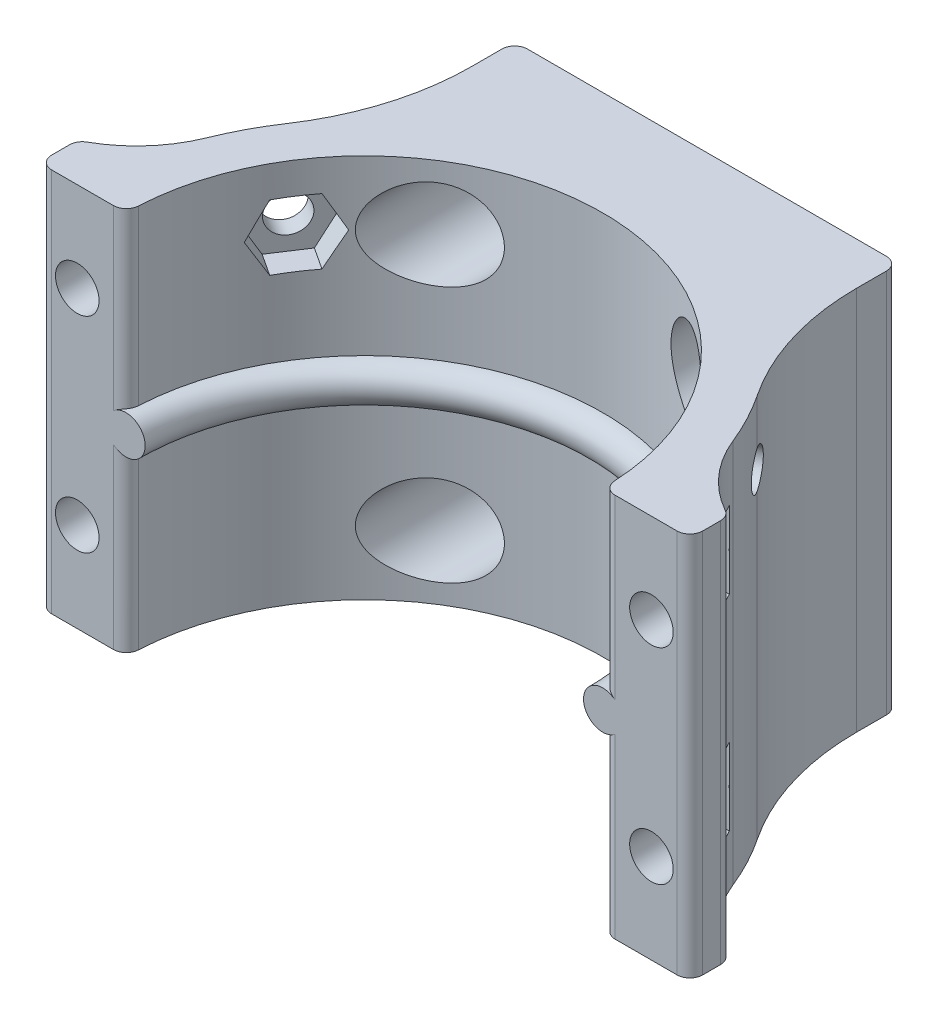
from build123d import *

# Parameters (mm, degrees)
ESQUISSE1_W                  = 30
ESQUISSE1_H                  = 30
BOSS_EXTRU_1_DEPTH           = 10.5
BOSS_EXTRU_2_DEPTH           = 15
ENL_V_MAT_EXTRU_1_DEPTH      = 48.535756267
R_VOLUTION1_ANGLE            = 180
CONG_1_R                     = 20
CONG_3_R                     = 10
CONG_4_R                     = 1
PER_AGEAVANC_1_START         = 4
PER_AGEAVANC_1_OUTLINE_R     = 3.5
PER_AGEAVANC_1_DEPTH         = 9.934989892
PER_AGEAVANC_1_2_OUTLINE_R   = 1.7
PER_AGEAVANC_1_2_DEPTH       = 4
PER_AGEAVANC_2_START         = 18.936607193
PER_AGEAVANC_2_OUTLINE_R     = 1.7
PER_AGEAVANC_2_DEPTH         = 7.793303466
ESQUISSE14_W                 = 7
ESQUISSE14_H                 = 6
ENL_V_MAT_EXTRU_2_DEPTH      = 4.5
ESQUISSE17_R                 = 1.45
ENL_V_MAT_EXTRU_3_DEPTH      = 47.458215221
ENL_V_START                  = -2
ENL_V_MAT_EXTRU_4_DEPTH      = 46.221534381
R_P_TITION_CIRCULAIRE5_COUNT = 2
R_P_TITION_CIRCULAIRE5_ANGLE = 247


# Read off the part's stored shape, not the designer's step: PerçageAvancé1, PerçageAvancé2
with BuildPart() as part:
    # Esquisse1 → Boss.-Extru.1 (new body)
    with BuildSketch(Plane.XY):
        Rectangle(ESQUISSE1_W, ESQUISSE1_H)
    extrude(amount=BOSS_EXTRU_1_DEPTH)

    # Esquisse4 → Boss.-Extru.2 (add, symmetric)
    with BuildSketch(Plane(origin=(0, 0, 0), x_dir=(1, 0, 0), z_dir=(0, 1, 0))):
        with BuildLine():
            Line((18.6, -26.729910659), (25.4, -26.729910659))
            Line((25.4, -26.729910659), (25.4, -23.729910659))
            Line((25.4, -23.729910659), (21.895433314, -23.729910659))
            ThreePointArc((21.895433314, -23.729910659), (0, -4.629910659), (-21.895433314, -23.729910659))
            Line((-21.895433314, -23.729910659), (-25.4, -23.729910659))
            Line((-25.4, -23.729910659), (-25.4, -26.729910659))
            Line((-25.4, -26.729910659), (-18.6, -26.729910659))
            ThreePointArc((-18.6, -26.729910659), (0, -8.129910659), (18.6, -26.729910659))
        make_face()
    extrude(amount=BOSS_EXTRU_2_DEPTH, both=True)

    # Esquisse9 → Enlèv. mat.-Extru.1 (cut, through all)
    with BuildSketch(Plane(origin=(0, 15, 0), x_dir=(1, 0, 0), z_dir=(0, 1, 0))):
        with BuildLine():
            Line((-9.085703055, -10.5), (9.085703055, -10.5))
            ThreePointArc((9.085703055, -10.5), (0, -8.129910659), (-9.085703055, -10.5))
        make_face()
    extrude(amount=-ENL_V_MAT_EXTRU_1_DEPTH, mode=Mode.SUBTRACT)

    # Esquisse5 → Révolution1 (revolve)
    with BuildSketch(Plane.XY.offset(26.729910659)):
        with BuildLine():
            Line((-18.6, 1.5), (-18.6, -1.5))
            ThreePointArc((-18.6, -1.5), (-17.1, 0), (-18.6, 1.5))
        make_face()
    revolve(axis=Axis((0, 15, 26.729910659), (0, -1, 0)), revolution_arc=R_VOLUTION1_ANGLE)

    # Congé1
    cong_1_edges = [part.edges().sort_by_distance(p)[0] for p in [
        (-15, 0, 10.5),
        (15, 0, 10.5),
    ]]
    fillet(cong_1_edges, radius=CONG_1_R)

    # Congé3
    # the kernel refuses this fillet: 10 mm, written as the material it adds along each edge
    with BuildSketch(Plane(origin=(21.895433314, 15, 23.729910659), x_dir=(-0.25660960080470496, 0, -0.9665151384095596), z_dir=(0, -1, 0))) as cong_3_piece_1:
        with BuildLine():
            CenterArc((6.668397642, 9.924025594), CONG_3_R, 220.819703099, 42.113109107)
            Line((-0.899305458, 3.387216756), (-1.05065952, 3.256480579))
            ThreePointArc((-1.05065952, 3.256480579), (-0.642955757, 1.642286458), (-0.193303028, -0.05132192))
            Line((-0.193303028, -0.05132192), (0.024606633, -0.198480512))
            ThreePointArc((0.024606633, -0.198480512), (2.719032987, -0.032096562), (5.41345934, -0.198480512))
            Line((5.41345934, -0.198480512), (5.438065974, 0))
        make_face()
    extrude(amount=30)
    with BuildSketch(Plane(origin=(-21.895433314, 15, 23.729910659), x_dir=(0.2566096008047045, 0, -0.9665151384095596), z_dir=(0, -1, 0))) as cong_3_piece_2:
        with BuildLine():
            CenterArc((6.668397642, -9.924025594), CONG_3_R, 97.067187794, 42.113109107)
            Line((-0.899305458, -3.387216756), (-1.05065952, -3.256480579))
            ThreePointArc((-1.05065952, -3.256480579), (-0.642955757, -1.642286458), (-0.193303028, 0.05132192))
            Line((-0.193303028, 0.05132192), (0.024606633, 0.198480512))
            ThreePointArc((0.024606633, 0.198480512), (2.719032987, 0.032096562), (5.41345934, 0.198480512))
            Line((5.41345934, 0.198480512), (5.438065974, 0))
        make_face()
    extrude(amount=30)

    # Congé4
    cong_4_edges = [part.edges().sort_by_distance(p)[0] for p in [
        (-18.6, 8.25, 26.729910659),
        (25.4, 0, 23.729910659),
        (-25.4, 0, 23.729910659),
        (-25.4, 0, 26.729910659),
        (18.6, 8.25, 26.729910659),
        (25.4, 0, 26.729910659),
        (-15, 0, 0),
        (-18.6, -8.25, 26.729910659),
        (18.6, -8.25, 26.729910659),
        (15, 0, 0),
    ]]
    fillet(cong_4_edges, radius=CONG_4_R)

    # PerçageAvancé1 outline → PerçageAvancé1 (cut)
    with BuildSketch(Plane.XY.offset(PER_AGEAVANC_1_START)):
        with Locations((-10, 10)):
            Circle(PER_AGEAVANC_1_OUTLINE_R)
        with Locations((-10, -10)):
            Circle(PER_AGEAVANC_1_OUTLINE_R)
        with Locations((10, -10)):
            Circle(PER_AGEAVANC_1_OUTLINE_R)
        with Locations((10, 10)):
            Circle(PER_AGEAVANC_1_OUTLINE_R)
    extrude(amount=PER_AGEAVANC_1_DEPTH, mode=Mode.SUBTRACT)

    # Per_ageAvanc_1 2 outline → Per_ageAvanc_1 2 (cut)
    with BuildSketch(Plane.XY):
        with Locations((-10, 10)):
            Circle(PER_AGEAVANC_1_2_OUTLINE_R)
        with Locations((-10, -10)):
            Circle(PER_AGEAVANC_1_2_OUTLINE_R)
        with Locations((10, -10)):
            Circle(PER_AGEAVANC_1_2_OUTLINE_R)
        with Locations((10, 10)):
            Circle(PER_AGEAVANC_1_2_OUTLINE_R)
    extrude(amount=PER_AGEAVANC_1_2_DEPTH, mode=Mode.SUBTRACT)

    # PerçageAvancé2 outline → PerçageAvancé2 (cut)
    with BuildSketch(Plane.XY.offset(PER_AGEAVANC_2_START)):
        with Locations((-22.4, -8)):
            Circle(PER_AGEAVANC_2_OUTLINE_R)
        with Locations((22.4, -8)):
            Circle(PER_AGEAVANC_2_OUTLINE_R)
        with Locations((22.4, 8)):
            Circle(PER_AGEAVANC_2_OUTLINE_R)
        with Locations((-22.4, 8)):
            Circle(PER_AGEAVANC_2_OUTLINE_R)
    extrude(amount=PER_AGEAVANC_2_DEPTH, mode=Mode.SUBTRACT)

    # Esquisse14 → Enlèv. mat.-Extru.2 (cut)
    with BuildSketch(Plane.XY.offset(23.462579803)):
        with Locations((22.4, 8)):
            Rectangle(ESQUISSE14_W, ESQUISSE14_H)
        with Locations((22.4, -8)):
            Rectangle(ESQUISSE14_W, ESQUISSE14_H)
        with Locations((-22.4, 8)):
            Rectangle(ESQUISSE14_W, ESQUISSE14_H)
        with Locations((-22.4, -8)):
            Rectangle(ESQUISSE14_W, ESQUISSE14_H)
    extrude(amount=-ENL_V_MAT_EXTRU_2_DEPTH, mode=Mode.SUBTRACT)

    # Esquisse17 → Enlèv. mat.-Extru.3 (cut, symmetric)
    with BuildSketch(Plane(origin=(6.023184209, 0, -4.02637726), x_dir=(0.5557433409087785, 0, 0.8313539192399043), z_dir=(-0.8313539192399042, 0, 0.5557433409087784))):
        with Locations(Location((22.222015987, 10, 0), (0, 0, 180))):
            Circle(ESQUISSE17_R)
    enl_v_mat_extru_3 = extrude(amount=ENL_V_MAT_EXTRU_3_DEPTH, both=True, mode=Mode.SUBTRACT)

    # Esquisse18 → Enlèv. mat.-Extru.4 (cut)
    with BuildSketch(Plane(origin=(3.113445491, 0, -2.081275566), x_dir=(0.5557433409087784, 0, 0.8313539192399043), z_dir=(-0.8313539192399043, 0, 0.5557433409087784)).offset(ENL_V_START)):
        Polygon((20.749772801, 12.55), (23.694259174, 12.55), (25.16650236, 10), (23.694259174, 7.45), (20.749772801, 7.45), (19.277529614, 10), align=None)
    enl_v_mat_extru_4 = extrude(amount=ENL_V_MAT_EXTRU_4_DEPTH, mode=Mode.SUBTRACT)

    # Répétition circulaire5: Enlèv. mat.-Extru.3, Enlèv. mat.-Extru.4 ×2 about axis
    r_p_tition_circulaire5_axis = Axis((0, 15, 26.729910659), (0, -1, 0))
    add([enl_v_mat_extru_3.rotate(r_p_tition_circulaire5_axis, i * R_P_TITION_CIRCULAIRE5_ANGLE / (R_P_TITION_CIRCULAIRE5_COUNT - 1)) for i in range(1, R_P_TITION_CIRCULAIRE5_COUNT)], mode=Mode.SUBTRACT)
    add([enl_v_mat_extru_4.rotate(r_p_tition_circulaire5_axis, i * R_P_TITION_CIRCULAIRE5_ANGLE / (R_P_TITION_CIRCULAIRE5_COUNT - 1)) for i in range(1, R_P_TITION_CIRCULAIRE5_COUNT)], mode=Mode.SUBTRACT)


solid = part.part
